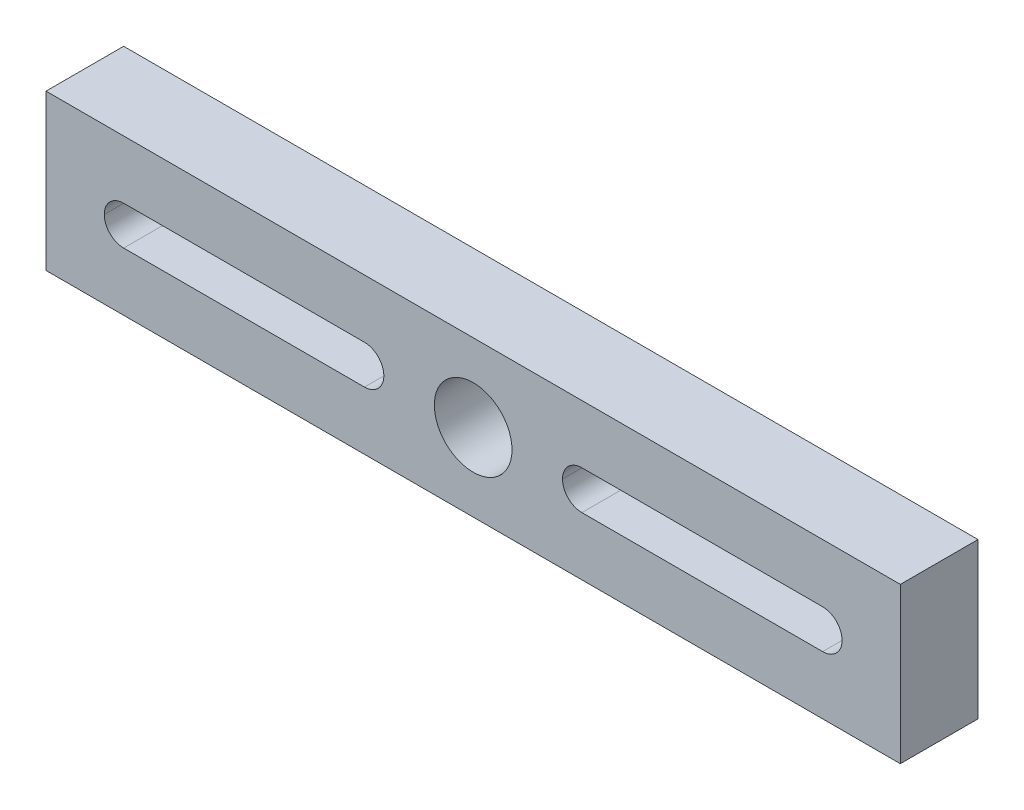
from build123d import *

# Parameters (mm, degrees)
SKETCH1_W           = 139.7
SKETCH1_H           = 25.4
SKETCH1_R           = 6.35
BOSS_EXTRUDE1_DEPTH = 12.7
SKETCH4_W           = 45.72
SKETCH4_H           = 6.35
CUT_EXTRUDE1_DEPTH  = 13.335
FILLET1_R           = 3.175


with BuildPart() as part:
    # Sketch1 → Boss-Extrude1 (new body)
    with BuildSketch(Plane.XY):
        Rectangle(SKETCH1_W, SKETCH1_H)
        Circle(SKETCH1_R, mode=Mode.SUBTRACT)
    extrude(amount=BOSS_EXTRUDE1_DEPTH)

    # Sketch4 → Cut-Extrude1 (cut)
    with BuildSketch(Plane.XY.offset(12.7)):
        with Locations((-37.465, 0)):
            Rectangle(SKETCH4_W, SKETCH4_H)
        with Locations((37.465, 0)):
            Rectangle(SKETCH4_W, SKETCH4_H)
    extrude(amount=-CUT_EXTRUDE1_DEPTH, mode=Mode.SUBTRACT)

    # Fillet1
    fillet1_edges = [part.edges().sort_by_distance(p)[0] for p in [
        (-14.605, 3.175, 6.35),
        (-14.605, -3.175, 6.35),
        (-60.325, -3.175, 6.35),
        (-60.325, 3.175, 6.35),
        (14.605, 3.175, 6.35),
        (14.605, -3.175, 6.35),
        (60.325, -3.175, 6.35),
        (60.325, 3.175, 6.35),
    ]]
    fillet(fillet1_edges, radius=FILLET1_R - 0.0001)  # a hair under: the kernel refuses the full size


solid = part.part
